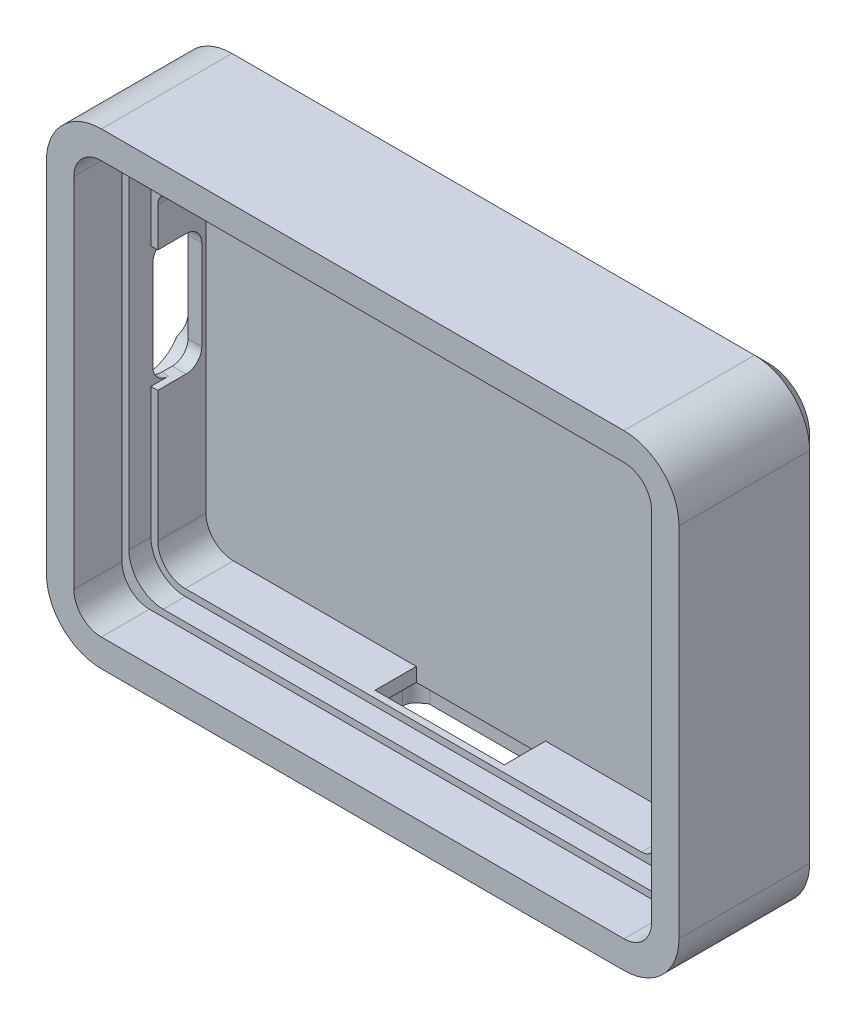
from build123d import *

# Parameters (mm, degrees)
SKETCH_1_W           = 46
SKETCH_1_H           = 34
EXTRUDE_1_DEPTH      = 7
CUT_EXTRUDE_1_DEPTH  = 1.6
CUT_EXTRUDE_2_DEPTH  = 3.5
FILLET_1_R           = 1
FILLET_2_R           = 4
SKETCH_5_R           = 0.85
CUT_EXTRUDE_3_DEPTH  = 4
CUT_EXTRUDE_4_REACH  = 51.538
CUT_EXTRUDE_5_DEPTH  = 2
SKETCH_7_W           = 9.4
SKETCH_7_H           = 3
CUT_EXTRUDE_6_DEPTH  = 3
SKETCH_8_W           = 11.4
SKETCH_8_H           = 5
SKETCH_8_W_2         = 9.4
SKETCH_8_H_2         = 3
CUT_EXTRUDE_7_DEPTH  = 2
FILLET_3_R           = 1
EXTRUDE_START        = 3.5
EXTRUDE_2_DEPTH      = 3.5
CHAMFER_1_SIZE       = 1
CUT_EXTRUDE_9_DEPTH  = 1.6
CUT_EXTRUDE_10_REACH = 31.106
SKETCH_11_W          = 0.5
SKETCH_11_H          = 8.840000414
CUT_EXTRUDE_11_DEPTH = 2


with BuildPart() as part:
    # 草图1 → 凸台-拉伸1 (new body)
    with BuildSketch(Plane.XY):
        Rectangle(SKETCH_1_W, SKETCH_1_H)
    extrude(amount=EXTRUDE_1_DEPTH)

    # 草图3 → 切除-拉伸1 (cut)
    with BuildSketch(Plane.XY.offset(7)):
        with BuildLine():
            Line((-18, -14), (18, -14))
            ThreePointArc((18, -14), (19.414213562, -13.414213562), (20, -12))
            Line((20, -12), (20, 12))
            ThreePointArc((20, 12), (19.414213562, 13.414213562), (18, 14))
            Line((18, 14), (-18, 14))
            ThreePointArc((-18, 14), (-19.414213562, 13.414213562), (-20, 12))
            Line((-20, 12), (-20, -12))
            ThreePointArc((-20, -12), (-19.414213562, -13.414213562), (-18, -14))
        make_face()
    extrude(amount=-CUT_EXTRUDE_1_DEPTH, mode=Mode.SUBTRACT)

    # 草图4 → 切除-拉伸2 (cut)
    with BuildSketch(Plane.XY.offset(5.4)):
        with BuildLine():
            ThreePointArc((20, 12), (16.585786438, 10.585786438), (18, 14))
            Line((18, 14), (-18, 14))
            ThreePointArc((-18, 14), (-16.585786438, 13.414213562), (-16, 12))
            ThreePointArc((-16, 12), (-18, 10), (-20, 12))
            Line((-20, 12), (-20, -12))
            ThreePointArc((-20, -12), (-19.414213562, -13.414213562), (-18, -14))
            Line((-18, -14), (18, -14))
            ThreePointArc((18, -14), (16.585786438, -10.585786438), (20, -12))
            Line((20, -12), (20, 12))
        make_face()
    extrude(amount=-CUT_EXTRUDE_2_DEPTH, mode=Mode.SUBTRACT)

    # 圆角1
    fillet_1_edges = [part.edges().sort_by_distance(p)[0] for p in [
        (18, 14, 3.65),
        (20, 12, 3.65),
        (20, -12, 3.65),
        (18, -14, 3.65),
        (-20, 12, 3.65),
        (-18, 14, 3.65),
    ]]
    fillet(fillet_1_edges, radius=FILLET_1_R)

    # 圆角2
    fillet_2_edges = [part.edges().sort_by_distance(p)[0] for p in [
        (23, -17, 3.5),
        (-23, -17, 3.5),
        (-23, 17, 3.5),
        (23, 17, 3.5),
    ]]
    fillet(fillet_2_edges, radius=FILLET_2_R)

    # 草图5 → 切除-拉伸3 (cut)
    with BuildSketch(Plane.XY.offset(5.4)):
        with Locations((-18, 12)):
            Circle(SKETCH_5_R)
        with Locations((18, 12)):
            Circle(SKETCH_5_R)
        with Locations((18, -12)):
            Circle(SKETCH_5_R)
    extrude(amount=-CUT_EXTRUDE_3_DEPTH, mode=Mode.SUBTRACT)

    # 草图6 → 切除-拉伸4 (cut, up to next)
    with BuildSketch(Plane.ZY.offset(23), mode=Mode.PRIVATE) as cut_extrude_4_sk1:
        with BuildLine():
            Line((4.109999831, 6.325004017), (3.349999795, 6.325004017))
            ThreePointArc((3.349999795, 6.325004017), (2.536826958, 5.9881768), (2.199999741, 5.175003963))
            Line((2.199999741, 5.175003963), (2.199999741, -1.364996343))
            ThreePointArc((2.199999741, -1.364996343), (2.536826958, -2.17816918), (3.349999795, -2.514996397))
            Line((3.349999795, -2.514996397), (4.109999831, -2.514996397))
            ThreePointArc((4.109999831, -2.514996397), (4.923172667, -2.17816918), (5.259999885, -1.364996343))
            Line((5.259999885, -1.364996343), (5.259999885, 5.175003963))
            ThreePointArc((5.259999885, 5.175003963), (4.923172667, 5.9881768), (4.109999831, 6.325004017))
        make_face()
    cut_extrude_4_tool1 = extrude(cut_extrude_4_sk1.sketch, amount=-CUT_EXTRUDE_4_REACH, mode=Mode.PRIVATE) & part.part
    add(cut_extrude_4_tool1.solids().sort_by_distance((-23, 1.905004, 3.73))[0], mode=Mode.SUBTRACT)

    # 草图6<3> → 切除-拉伸5 (cut)
    with BuildSketch(Plane.ZY.offset(23)):
        with BuildLine():
            Line((3.349999795, -4.014996397), (4.109999831, -4.014996397))
            ThreePointArc((4.109999831, -4.014996397), (5.983832839, -3.238829352), (6.759999885, -1.364996343))
            Line((6.759999885, -1.364996343), (6.759999885, 5.175003963))
            ThreePointArc((6.759999885, 5.175003963), (5.983832839, 7.048836972), (4.109999831, 7.825004017))
            Line((4.109999831, 7.825004017), (3.349999795, 7.825004017))
            ThreePointArc((3.349999795, 7.825004017), (1.476166787, 7.048836972), (0.699999741, 5.175003963))
            Line((0.699999741, 5.175003963), (0.699999741, -1.364996343))
            ThreePointArc((0.699999741, -1.364996343), (1.476166787, -3.238829352), (3.349999795, -4.014996397))
        make_face()
        with BuildLine():
            Line((3.349999795, -2.514996397), (4.109999831, -2.514996397))
            ThreePointArc((4.109999831, -2.514996397), (4.923172667, -2.17816918), (5.259999885, -1.364996343))
            Line((5.259999885, -1.364996343), (5.259999885, 5.175003963))
            ThreePointArc((5.259999885, 5.175003963), (4.923172667, 5.9881768), (4.109999831, 6.325004017))
            Line((4.109999831, 6.325004017), (3.349999795, 6.325004017))
            ThreePointArc((3.349999795, 6.325004017), (2.536826958, 5.9881768), (2.199999741, 5.175003963))
            Line((2.199999741, 5.175003963), (2.199999741, -1.364996343))
            ThreePointArc((2.199999741, -1.364996343), (2.536826958, -2.17816918), (3.349999795, -2.514996397))
        make_face(mode=Mode.SUBTRACT)
    extrude(amount=-CUT_EXTRUDE_5_DEPTH, mode=Mode.SUBTRACT)

    # 草图7 → 切除-拉伸6 (cut)
    with BuildSketch(Plane.XZ.offset(17)):
        with Locations((0, 3.4)):
            Rectangle(SKETCH_7_W, SKETCH_7_H)
    extrude(amount=-CUT_EXTRUDE_6_DEPTH, mode=Mode.SUBTRACT)

    # 草图8 → 切除-拉伸7 (cut)
    with BuildSketch(Plane.XZ.offset(17)):
        with Locations((0, 3.4)):
            Rectangle(SKETCH_8_W, SKETCH_8_H)
        with Locations((0, 3.4)):
            Rectangle(SKETCH_8_W_2, SKETCH_8_H_2, mode=Mode.SUBTRACT)
    extrude(amount=-CUT_EXTRUDE_7_DEPTH, mode=Mode.SUBTRACT)

    # 圆角3
    fillet_3_edges = [part.edges().sort_by_distance(p)[0] for p in [
        (5.7, -16, 0.9),
        (-5.7, -16, 0.9),
        (-5.7, -16, 5.9),
        (5.7, -16, 5.9),
    ]]
    fillet(fillet_3_edges, radius=FILLET_3_R)

    # 草图9 → 凸台-拉伸2 (add)
    with BuildSketch(Plane.XY.offset(7).offset(EXTRUDE_START)):
        with BuildLine():
            Line((-19, -17), (19, -17))
            ThreePointArc((19, -17), (21.828427125, -15.828427125), (23, -13))
            Line((23, -13), (23, 13))
            ThreePointArc((23, 13), (21.828427125, 15.828427125), (19, 17))
            Line((19, 17), (-19, 17))
            ThreePointArc((-19, 17), (-21.828427125, 15.828427125), (-23, 13))
            Line((-23, 13), (-23, -13))
            ThreePointArc((-23, -13), (-21.828427125, -15.828427125), (-19, -17))
        make_face()
        with BuildLine():
            Line((-19, -15), (19, -15))
            ThreePointArc((19, -15), (20.414213562, -14.414213562), (21, -13))
            Line((21, -13), (21, 13))
            ThreePointArc((21, 13), (20.414213562, 14.414213562), (19, 15))
            Line((19, 15), (-19, 15))
            ThreePointArc((-19, 15), (-20.414213562, 14.414213562), (-21, 13))
            Line((-21, 13), (-21, -13))
            ThreePointArc((-21, -13), (-20.414213562, -14.414213562), (-19, -15))
        make_face(mode=Mode.SUBTRACT)
    extrude(amount=-EXTRUDE_2_DEPTH)

    # 倒角1
    # the kernel refuses this chamfer: 1 mm, written as the material it takes off along each edge
    with BuildSketch(Plane(origin=(19, 13, 0), x_dir=(1, 0, 0), z_dir=(0, -1, 0))) as chamfer_1_piece_1:
        Polygon((4, CHAMFER_1_SIZE), (4 - CHAMFER_1_SIZE, 0), (4, 0), align=None)
    revolve(axis=Axis((19, 13, 0), (0, 0, 1)), revolution_arc=90, mode=Mode.SUBTRACT)
    with BuildSketch(Plane(origin=(19, 17, 0), x_dir=(0, 0.02749587661058563, 0.9996219169112968), z_dir=(-1, 0, 0)), Plane(origin=(-19, -17, 0), x_dir=(0, -0.02749587661058563, 0.9996219169112968), z_dir=(1, 0, 0))) as chamfer_1_piece_2:
        Polygon((CHAMFER_1_SIZE * 0.999621916911, -CHAMFER_1_SIZE * 0.0274958766106), (-CHAMFER_1_SIZE * 0.0274958766106, -CHAMFER_1_SIZE * 0.999621916911), (0, 0), align=None)
    extrude(amount=38, mode=Mode.SUBTRACT)
    with BuildSketch(Plane(origin=(-19, 13, 0), x_dir=(-1, 0, 0), z_dir=(0, -1, 0))) as chamfer_1_piece_3:
        Polygon((4, -CHAMFER_1_SIZE), (4 - CHAMFER_1_SIZE, 0), (4, 0), align=None)
    revolve(axis=Axis((-19, 13, 0), (0, 0, -1)), revolution_arc=90, mode=Mode.SUBTRACT)
    with BuildSketch(Plane(origin=(-23, 13, 0), x_dir=(-0.02749587661058563, 0, 0.9996219169112968), z_dir=(0, -1, 0)), Plane(origin=(23, -13, 0), x_dir=(0.02749587661058563, 0, 0.9996219169112968), z_dir=(0, 1, 0))) as chamfer_1_piece_4:
        Polygon((CHAMFER_1_SIZE * 0.999621916911, -CHAMFER_1_SIZE * 0.0274958766106), (-CHAMFER_1_SIZE * 0.0274958766106, -CHAMFER_1_SIZE * 0.999621916911), (0, 0), align=None)
    extrude(amount=26, mode=Mode.SUBTRACT)
    with BuildSketch(Plane(origin=(-19, -13, 0), x_dir=(0, -1, 0), z_dir=(1, 0, 0))) as chamfer_1_piece_5:
        Polygon((4, -CHAMFER_1_SIZE), (4 - CHAMFER_1_SIZE, 0), (4, 0), align=None)
    revolve(axis=Axis((-19, -13, 0), (0, 0, -1)), revolution_arc=90, mode=Mode.SUBTRACT)
    with BuildSketch(Plane(origin=(19, -13, 0), x_dir=(0, -1, 0), z_dir=(-1, 0, 0))) as chamfer_1_piece_6:
        Polygon((4, CHAMFER_1_SIZE), (4 - CHAMFER_1_SIZE, 0), (4, 0), align=None)
    revolve(axis=Axis((19, -13, 0), (0, 0, 1)), revolution_arc=90, mode=Mode.SUBTRACT)

    # 草图10 → 切除-拉伸9 (cut)
    # profile 1 of 2: a face of its own
    with BuildSketch(Plane.XY.offset(7)):
        with BuildLine():
            Line((-18, -14.5), (18, -14.5))
            ThreePointArc((18, -14.5), (19.767766953, -13.767766953), (20.5, -12))
            Line((20.5, -12), (20.5, 12))
            ThreePointArc((20.5, 12), (19.767766953, 13.767766953), (18, 14.5))
            Line((18, 14.5), (-18, 14.5))
            ThreePointArc((-18, 14.5), (-19.767766953, 13.767766953), (-20.5, 12))
            Line((-20.5, 12), (-20.5, 9.171572875))
            Line((-20.5, 9.171572875), (-20.5, -12))
            ThreePointArc((-20.5, -12), (-19.767766953, -13.767766953), (-18, -14.5))
        make_face()
        with BuildLine():
            ThreePointArc((-20, 12), (-19.414213562, 13.414213562), (-18, 14))
            Line((-18, 14), (18, 14))
            ThreePointArc((18, 14), (19.414213562, 13.414213562), (20, 12))
            Line((20, 12), (20, -12))
            ThreePointArc((20, -12), (19.414213562, -13.414213562), (18, -14))
            Line((18, -14), (-18, -14))
            ThreePointArc((-18, -14), (-19.414213562, -13.414213562), (-20, -12))
            Line((-20, -12), (-20, 12))
        make_face(mode=Mode.SUBTRACT)
    # profile 2 of 2: a face of its own
    with BuildSketch(Plane.XY.offset(7)):
        with BuildLine():
            ThreePointArc((20, 12), (19.414213562, 13.414213562), (18, 14))
            Line((18, 14), (-18, 14))
            ThreePointArc((-18, 14), (-19.414213562, 13.414213562), (-20, 12))
            Line((-20, 12), (-20, 9.171572875))
            Line((-20, 9.171572875), (-20, -12))
            ThreePointArc((-20, -12), (-19.414213562, -13.414213562), (-18, -14))
            Line((-18, -14), (18, -14))
            ThreePointArc((18, -14), (19.414213562, -13.414213562), (20, -12))
            Line((20, -12), (20, 12))
        make_face()
    extrude(amount=-CUT_EXTRUDE_9_DEPTH, mode=Mode.SUBTRACT)

    # 草图11 → 切除-拉伸10 (cut, up to next)
    with BuildSketch(Plane.XY.offset(5.4), mode=Mode.PRIVATE) as cut_extrude_10_sk1:
        with Locations((-20.25, 1.90500381)):
            Rectangle(SKETCH_11_W, SKETCH_11_H)
    cut_extrude_10_tool1 = extrude(cut_extrude_10_sk1.sketch, amount=-CUT_EXTRUDE_10_REACH, mode=Mode.PRIVATE) & part.part
    add(cut_extrude_10_tool1.solids().sort_by_distance((-20.25, 1.905004, 5.4))[0], mode=Mode.SUBTRACT)

    # 草图12 → 切除-拉伸11 (cut)
    with BuildSketch(Plane.ZY.offset(23)):
        with BuildLine():
            Line((0.599999741, 5.175003963), (0.599999741, -1.364996343))
            ThreePointArc((0.599999741, -1.364996343), (1.405456108, -3.30954003), (3.349999795, -4.114996397))
            Line((3.349999795, -4.114996397), (4.109999831, -4.114996397))
            ThreePointArc((4.109999831, -4.114996397), (6.054543517, -3.30954003), (6.859999885, -1.364996343))
            Line((6.859999885, -1.364996343), (6.859999885, 5.175003963))
            ThreePointArc((6.859999885, 5.175003963), (6.054543517, 7.11954765), (4.109999831, 7.925004017))
            Line((4.109999831, 7.925004017), (3.349999795, 7.925004017))
            ThreePointArc((3.349999795, 7.925004017), (1.405456108, 7.11954765), (0.599999741, 5.175003963))
        make_face()
    extrude(amount=-CUT_EXTRUDE_11_DEPTH, mode=Mode.SUBTRACT)


solid = part.part
